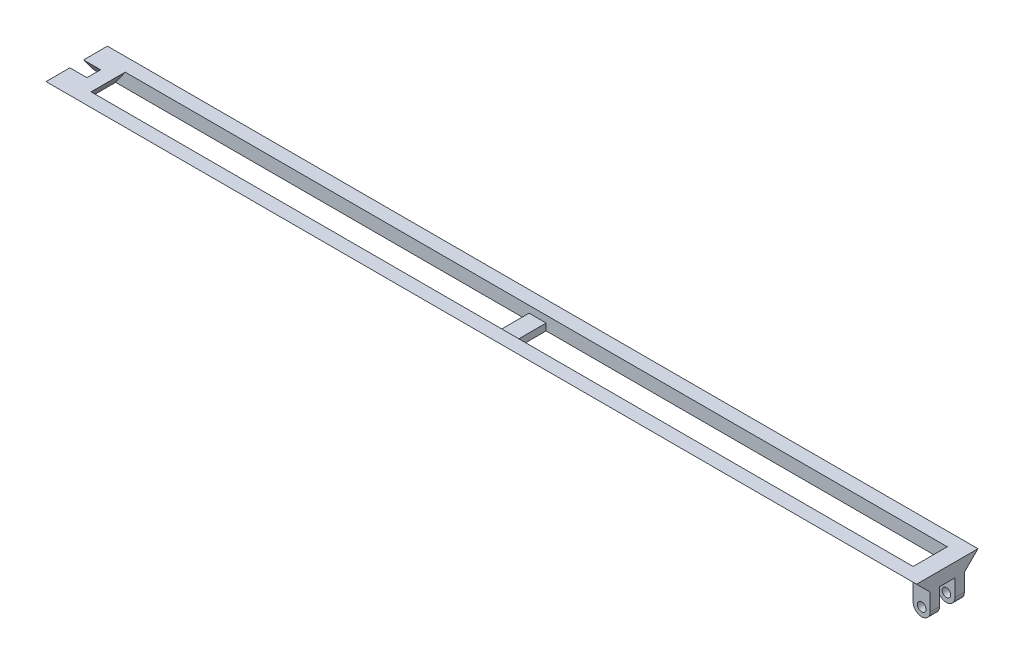
from build123d import *

# Parameters (mm, degrees)
SKETCH2_W            = 323.85
SKETCH2_H            = 22.86
SKETCH2_W_2          = 304.8
SKETCH2_H_2          = 12.7
BOSS_EXTRUDE1_DEPTH  = 5.08
CUT_EXTRUDE1_DEPTH   = 6.35
SKETCH4_W            = 6.35
SKETCH4_H            = 12.7
BOSS_EXTRUDE2_DEPTH  = 2.54
CUT_EXTRUDE3_DEPTH   = 325.091459005
CHAMFER5_SIZE        = 6.5287398
CHAMFER5_SIZE_2      = 4.571472823
BOSS_EXTRUDE4_DEPTH  = 6.35
CUT_EXTRUDE5_DEPTH   = 2.8575
M3_CLEARANCE_HOLE1_D = 3.2


with BuildPart() as part:
    # Sketch2 → Boss-Extrude1 (new body)
    with BuildSketch(Plane(origin=(0, 0, 0), x_dir=(1, 0, 0), z_dir=(0, 1, 0))):
        with Locations((-3.175, 0)):
            Rectangle(SKETCH2_W, SKETCH2_H)
        Rectangle(SKETCH2_W_2, SKETCH2_H_2, mode=Mode.SUBTRACT)
    extrude(amount=BOSS_EXTRUDE1_DEPTH)

    # Sketch3 → Cut-Extrude1 (cut)
    with BuildSketch(Plane.ZY.offset(165.1)):
        Polygon((-2.54, 5.08), (2.54, 5.08), (6.35, 0), (-6.35, 0), align=None)
    extrude(amount=-CUT_EXTRUDE1_DEPTH, mode=Mode.SUBTRACT)

    # Sketch4 → Boss-Extrude2 (add)
    with BuildSketch(Plane(origin=(0, 0, 0), x_dir=(1, 0, 0), z_dir=(0, 1, 0))):
        Rectangle(SKETCH4_W, SKETCH4_H)
    extrude(amount=BOSS_EXTRUDE2_DEPTH)

    # Sketch6 → Cut-Extrude3 (cut, through all)
    with BuildSketch(Plane(origin=(158.75, 0, 0), x_dir=(0, 0, -1), z_dir=(1, 0, 0))):
        Polygon((-11.43, 5.08), (-6.35, 0), (-11.43, 0), align=None)
        Polygon((11.43, 0), (6.35, 0), (11.43, 5.08), align=None)
    extrude(amount=-CUT_EXTRUDE3_DEPTH, mode=Mode.SUBTRACT)

    # Chamfer5
    # the kernel refuses this chamfer: 6.5287398, 4.571472823 mm, written as the material it takes off along each edge
    with BuildSketch(Plane(origin=(-152.4, 0, -6.35), x_dir=(0.02220967419845904, 0.9997533347641299, 0), z_dir=(0, 0, 1))) as chamfer5_piece_1:
        Polygon((CHAMFER5_SIZE * 0.999753334764, CHAMFER5_SIZE * 0.0222096741985), (-CHAMFER5_SIZE_2 * 0.0222096741983, CHAMFER5_SIZE_2 * 0.999753334758), (0, 0), align=None)
    extrude(amount=12.7, mode=Mode.SUBTRACT)

    # Sketch8 → Boss-Extrude4 (add, symmetric)
    with BuildSketch(Plane.XY):
        with BuildLine():
            Line((152.4, 0), (152.4, -6.35))
            ThreePointArc((152.4, -6.35), (155.575, -9.525), (158.75, -6.35))
            Line((158.75, -6.35), (158.75, 0))
            Line((158.75, 0), (152.4, 0))
        make_face()
    extrude(amount=BOSS_EXTRUDE4_DEPTH, both=True)

    # Sketch8<2> → Cut-Extrude5 (cut, symmetric)
    with BuildSketch(Plane.XY):
        with BuildLine():
            Line((152.4, 0), (152.4, -6.35))
            ThreePointArc((152.4, -6.35), (155.575, -9.525), (158.75, -6.35))
            Line((158.75, -6.35), (158.75, 0))
            Line((158.75, 0), (152.4, 0))
        make_face()
    extrude(amount=CUT_EXTRUDE5_DEPTH, both=True, mode=Mode.SUBTRACT)

    # M3 Clearance Hole1 (through all)
    with Locations(Plane.XY.offset(6.35)):
        with Locations((155.575, -6.35)):
            Hole(M3_CLEARANCE_HOLE1_D / 2)


solid = part.part
